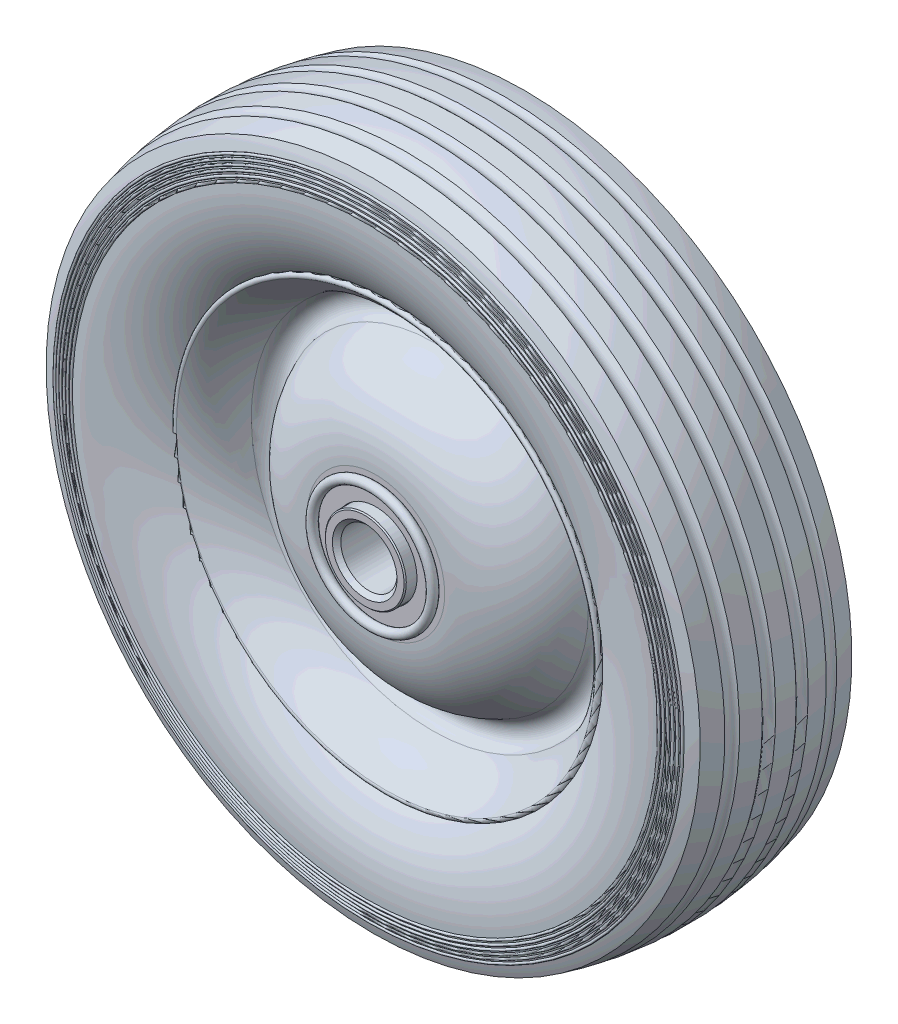
from build123d import *

# Parameters (mm, degrees)
CHAMFER1_SIZE = 0.9525
CHAMFER2_SIZE = 0.9525
CHAMFER3_SIZE = 0.254
CHAMFER4_SIZE = 0.254
SKETCH13_R    = 0.3048


# Read off the part's stored shape, not the designer's step: Cut-Revolve2
with BuildPart() as part:
    # Sketch2 → Revolve1 (revolve)
    with BuildSketch(Plane(origin=(0, 0, 0), x_dir=(0, 0, -1), z_dir=(1, 0, 0)), mode=Mode.PRIVATE) as revolve1_sk:
        with BuildLine():
            ThreePointArc((17.145, 73.914), (0, 76.2), (-17.145, 73.914))
            ThreePointArc((-17.145, 73.914), (-18.775626493, 60.485337264), (-13.335, 48.100366169))
            ThreePointArc((-13.335, 48.100366169), (0, 41.7449), (13.335, 48.100366169))
            ThreePointArc((13.335, 48.100366169), (18.775626493, 60.485337264), (17.145, 73.914))
        make_face()
    revolve(revolve1_sk.sketch.rotate(Axis((0, 0, 19.05), (0, 0, -1)), 180), axis=Axis((0, 0, 19.05), (0, 0, -1)))


with BuildPart() as body_2:
    # Sketch2<5> → Revolve7 (revolve)
    with BuildSketch(Plane(origin=(0, 0, 0), x_dir=(0, 0, -1), z_dir=(1, 0, 0)), mode=Mode.PRIVATE) as revolve7_sk:
        with BuildLine():
            ThreePointArc((-3.321977667, 34.807265708), (-12.897117819, 27.217058974), (-16.51, 15.5448))
            Line((-16.51, 15.5448), (-16.51, 14.2748))
            Line((-16.51, 14.2748), (16.51, 14.2748))
            Line((16.51, 14.2748), (16.51, 15.5448))
            ThreePointArc((16.51, 15.5448), (12.897117819, 27.217058974), (3.321977667, 34.807265708))
            ThreePointArc((3.321977667, 34.807265708), (1.305777958, 38.023791397), (3.813670837, 40.873628601))
            ThreePointArc((3.813670837, 40.873628601), (9.620147428, 43.183641383), (14.321486597, 47.300526064))
            ThreePointArc((14.321486597, 47.300526064), (14.228163351, 48.193689415), (13.335, 48.100366169))
            ThreePointArc((13.335, 48.100366169), (8.957496492, 44.267059002), (3.550979171, 42.116163546))
            ThreePointArc((3.550979171, 42.116163546), (0.039929141, 38.126391461), (2.862608733, 33.623255495))
            ThreePointArc((2.862608733, 33.623255495), (11.481677799, 27.017960747), (15.198367326, 16.8148))
            Line((15.198367326, 16.8148), (15.198367326, 15.5448))
            Line((15.198367326, 15.5448), (-15.198367326, 15.5448))
            Line((-15.198367326, 15.5448), (-15.198367326, 16.8148))
            ThreePointArc((-15.198367326, 16.8148), (-11.481677799, 27.017960747), (-2.862608733, 33.623255495))
            ThreePointArc((-2.862608733, 33.623255495), (-0.039929141, 38.126391461), (-3.550979171, 42.116163546))
            ThreePointArc((-3.550979171, 42.116163546), (-8.957496492, 44.267059002), (-13.335, 48.100366169))
            ThreePointArc((-13.335, 48.100366169), (-14.228163351, 48.193689415), (-14.321486597, 47.300526064))
            ThreePointArc((-14.321486597, 47.300526064), (-9.620147428, 43.183641383), (-3.813670837, 40.873628601))
            ThreePointArc((-3.813670837, 40.873628601), (-1.305777958, 38.023791397), (-3.321977667, 34.807265708))
        make_face()
    revolve(revolve7_sk.sketch.rotate(Axis((0, 0, 19.05), (0, 0, -1)), 180), axis=Axis((0, 0, 19.05), (0, 0, -1)))


with BuildPart() as body_3:
    # Sketch2<6> → Revolve8 (revolve)
    with BuildSketch(Plane(origin=(0, 0, 0), x_dir=(0, 0, -1), z_dir=(1, 0, 0)), mode=Mode.PRIVATE) as revolve8_sk:
        with BuildLine():
            ThreePointArc((16.51, 14.2494), (18.319114746, 13.6144), (16.51, 12.9794))
            Line((16.51, 12.9794), (-16.51, 12.9794))
            ThreePointArc((-16.51, 12.9794), (-18.319114746, 13.6144), (-16.51, 14.2494))
            Line((-16.51, 14.2494), (16.51, 14.2494))
        make_face()
    revolve(revolve8_sk.sketch.rotate(Axis((0, 0, 19.05), (0, 0, -1)), 180), axis=Axis((0, 0, 19.05), (0, 0, -1)))


with BuildPart() as body_4:
    # Sketch2<7> → Revolve9 (revolve)
    with BuildSketch(Plane(origin=(0, 0, 0), x_dir=(0, 0, -1), z_dir=(1, 0, 0)), mode=Mode.PRIVATE) as revolve9_sk:
        with BuildLine():
            Line((16.51, 12.954), (8.89, 12.954))
            ThreePointArc((8.89, 12.954), (7.991974388, 12.582025612), (7.62, 11.684))
            Line((7.62, 11.684), (7.62, 9.271))
            Line((7.62, 9.271), (11.113770508, 9.271))
            ThreePointArc((11.113770508, 9.271), (12.7, 10.795), (14.286229492, 9.271))
            Line((14.286229492, 9.271), (16.51, 9.271))
            Line((16.51, 9.271), (16.51, 12.954))
        make_face()
        with BuildLine():
            ThreePointArc((-11.113770508, 9.271), (-12.7, 10.795), (-14.286229492, 9.271))
            Line((-14.286229492, 9.271), (-16.51, 9.271))
            Line((-16.51, 9.271), (-16.51, 12.954))
            Line((-16.51, 12.954), (-8.89, 12.954))
            ThreePointArc((-8.89, 12.954), (-7.991974388, 12.582025612), (-7.62, 11.684))
            Line((-7.62, 11.684), (-7.62, 9.271))
            Line((-7.62, 9.271), (-11.113770508, 9.271))
        make_face()
        with BuildLine():
            ThreePointArc((-14.286229492, 9.144), (-12.7, 7.62), (-11.113770508, 9.144))
            Line((-11.113770508, 9.144), (-7.62, 9.144))
            Line((-7.62, 9.144), (-7.62, 6.35))
            Line((-7.62, 6.35), (-19.05, 6.35))
            Line((-19.05, 6.35), (-19.05, 9.144))
            Line((-19.05, 9.144), (-14.286229492, 9.144))
        make_face()
        with BuildLine():
            Line((19.05, 9.144), (14.286229492, 9.144))
            ThreePointArc((14.286229492, 9.144), (12.7, 7.62), (11.113770508, 9.144))
            Line((11.113770508, 9.144), (7.62, 9.144))
            Line((7.62, 9.144), (7.62, 6.35))
            Line((7.62, 6.35), (19.05, 6.35))
            Line((19.05, 6.35), (19.05, 9.144))
        make_face()
    revolve(revolve9_sk.sketch.rotate(Axis((0, 0, 19.05), (0, 0, -1)), 180), axis=Axis((0, 0, 19.05), (0, 0, -1)))

    # Chamfer1
    chamfer1_edges = [body_4.edges().sort_by_distance(p)[0] for p in [
        (0, 6.35, 19.05),
    ]]
    chamfer(chamfer1_edges, length=CHAMFER1_SIZE)

    # Chamfer2
    chamfer2_edges = [body_4.edges().sort_by_distance(p)[0] for p in [
        (0, 6.35, -19.05),
    ]]
    chamfer(chamfer2_edges, length=CHAMFER2_SIZE)

    # Chamfer3
    chamfer3_edges = [body_4.edges().sort_by_distance(p)[0] for p in [
        (0, 9.144, 19.05),
    ]]
    chamfer(chamfer3_edges, length=CHAMFER3_SIZE)

    # Chamfer4
    chamfer4_edges = [body_4.edges().sort_by_distance(p)[0] for p in [
        (0, 9.144, -19.05),
    ]]
    chamfer(chamfer4_edges, length=CHAMFER4_SIZE)


with BuildPart() as body_5:
    # Sketch13 → Revolve10 (revolve)
    with BuildSketch(Plane(origin=(0, 0, 0), x_dir=(0, 0, -1), z_dir=(1, 0, 0)), mode=Mode.PRIVATE) as revolve10_sk:
        with Locations((-18.15268573, 70.941846309)):
            Circle(SKETCH13_R)
        with Locations((-18.953296417, 66.446413301)):
            Circle(SKETCH13_R)
        with Locations((-18.85763705, 67.355795864)):
            Circle(SKETCH13_R)
        with Locations((-18.729562353, 68.261182098)):
            Circle(SKETCH13_R)
        with Locations((-18.569235725, 69.161416918)):
            Circle(SKETCH13_R)
        with Locations((-18.376861707, 70.055351814)):
            Circle(SKETCH13_R)
    revolve10 = revolve(revolve10_sk.sketch.rotate(Axis((0, 0, 19.05), (0, 0, -1)), 180), axis=Axis((0, 0, 19.05), (0, 0, -1)))


with BuildPart() as part_1:
    add(part.part)

    # Mirror2: Revolve10 across plane
    add(revolve10.mirror(Plane.XY))

    # Cut-Revolve2 outline → Cut-Revolve2 (revolve, cut)
    with BuildSketch(Plane.XZ):
        with BuildLine():
            Line((75.462009627, -12.615192444), (75.462009627, -9.799936393))
            ThreePointArc((75.462009627, -9.799936393), (74.607001124, -11.101452401), (74.972479634, -12.615192444))
            Line((74.972479634, -12.615192444), (75.462009627, -12.615192444))
        make_face()
        with BuildLine():
            ThreePointArc((76.158650195, -2.325915714), (75.458321653, -3.716787165), (75.994754632, -5.178711622))
            Line((75.994754632, -5.178711622), (76.158650195, -5.178711622))
            Line((76.158650195, -5.178711622), (76.158650195, -2.325915714))
        make_face()
        with BuildLine():
            Line((76.158650195, 2.325915714), (76.158650195, 5.178711622))
            Line((76.158650195, 5.178711622), (75.994754631, 5.178711622))
            ThreePointArc((75.994754631, 5.178711622), (75.458321653, 3.716787165), (76.158650195, 2.325915714))
        make_face()
        with BuildLine():
            Line((75.462009627, 12.615192444), (74.972479634, 12.615192444))
            ThreePointArc((74.972479634, 12.615192444), (74.607001124, 11.101452401), (75.462009627, 9.799936393))
            Line((75.462009627, 9.799936393), (75.462009627, 12.615192444))
        make_face()
    revolve(axis=Axis((0, 0, 0), (0, 0, 1)), mode=Mode.SUBTRACT)

    # Combine1: union body 5
    add(body_5.part)


solid = Compound([body_2.part, body_3.part, body_4.part, part_1.part])
